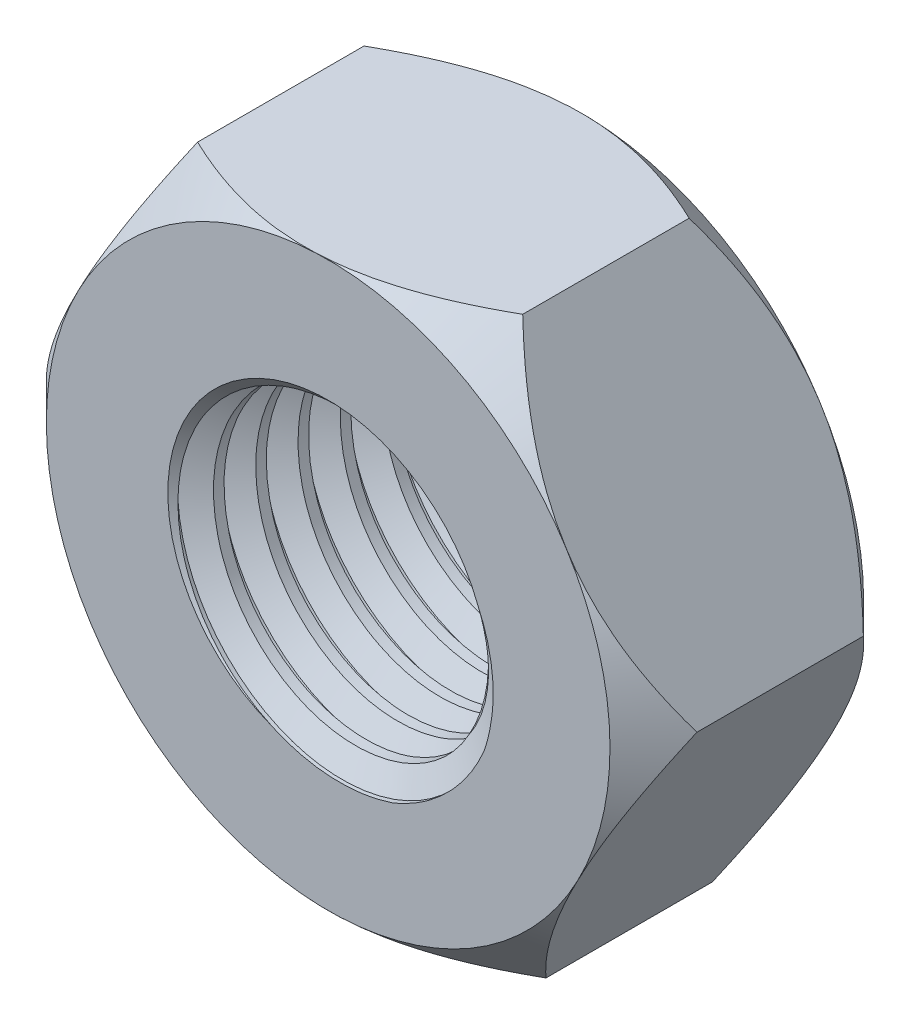
from build123d import *

# Parameters (mm, degrees)
BOSS_EXTRUDE1_DEPTH     = 4.5
SKETCH3_OUTSIDE_W       = 69.206
SKETCH3_OUTSIDE_H       = 66.592
SKETCH3_OUTSIDE_R       = 10
CUT_EXTRUDE1_DEPTH      = 18.853777356
CUT_EXTRUDE1_DRAFT      = -45
MIRROR1_COPY_1_SKETCH_W = 69.206
MIRROR1_COPY_1_SKETCH_H = 66.592
MIRROR1_COPY_1_SKETCH_R = 10
MIRROR1_COPY_1_DEPTH    = 18.853777356
MIRROR1_COPY_1_DRAFT    = -45
SKETCH4_R               = 5.19
CUT_EXTRUDE2_DEPTH      = 18.853777356
CHAMFER1_SIZE           = 0.5
THREAD1_PITCH           = 1.5


with BuildPart() as part:
    # Sketch2 → Boss-Extrude1 (new, symmetric)
    with BuildSketch(Plane.XY):
        Polygon((-11.537151797, -0.476929503), (-5.355542833, -10.229931295), (6.181608964, -9.753001792), (11.537151797, 0.476929503), (5.355542833, 10.229931295), (-6.181608964, 9.753001792), align=None)
    extrude(amount=BOSS_EXTRUDE1_DEPTH, both=True)


with BuildPart() as cut_extrude1_tool:
    # Sketch3 outside → Cut-Extrude1 (with draft: the straight prism first)
    with BuildSketch(Plane.XY.offset(4.5)):
        Rectangle(SKETCH3_OUTSIDE_W, SKETCH3_OUTSIDE_H)
        Circle(SKETCH3_OUTSIDE_R, mode=Mode.SUBTRACT)
    extrude(amount=-CUT_EXTRUDE1_DEPTH)
    # Cut-Extrude1: the draft: its side faces are tilted about the plane it starts from
    cut_extrude1_sides = [cut_extrude1_tool.faces().sort_by_distance(p)[0] for p in [
        (0, -33.296, -4.926888678),
        (34.603, 0, -4.926888678),
        (0, 33.296, -4.926888678),
        (-34.603, 0, -4.926888678),
        (-10, 0, -4.926888678),
    ]]
    draft(cut_extrude1_sides, Plane.XY.offset(4.5), CUT_EXTRUDE1_DRAFT)


with BuildPart() as part_1:
    add(part.part)

    # Cut-Extrude1: cut by cut_extrude1_tool
    add(cut_extrude1_tool.part, mode=Mode.SUBTRACT)


with BuildPart() as mirror1_copy_1_tool:
    # Mirror1 copy 1 sketch → Mirror1 copy 1 (with draft: the straight prism first)
    with BuildSketch(Plane(origin=(0, 0, -4.5), x_dir=(1, 0, 0), z_dir=(0, 0, -1))):
        Rectangle(MIRROR1_COPY_1_SKETCH_W, MIRROR1_COPY_1_SKETCH_H)
        Circle(MIRROR1_COPY_1_SKETCH_R, mode=Mode.SUBTRACT)
    extrude(amount=-MIRROR1_COPY_1_DEPTH)
    # Mirror1 copy 1: the draft: its side faces are tilted about the plane it starts from
    mirror1_copy_1_sides = [mirror1_copy_1_tool.faces().sort_by_distance(p)[0] for p in [
        (0, -33.296, 4.926888678),
        (34.603, 0, 4.926888678),
        (0, 33.296, 4.926888678),
        (-34.603, 0, 4.926888678),
        (-10, 0, 4.926888678),
    ]]
    draft(mirror1_copy_1_sides, Plane(origin=(0, 0, -4.5), x_dir=(1, 0, 0), z_dir=(0, 0, -1)), MIRROR1_COPY_1_DRAFT)


with BuildPart() as part_2:
    add(part_1.part)

    # Mirror1 copy 1: cut by mirror1_copy_1_tool
    add(mirror1_copy_1_tool.part, mode=Mode.SUBTRACT)

    # Sketch4 → Cut-Extrude2 (cut, through all)
    with BuildSketch(Plane.XY.offset(4.5)):
        Circle(SKETCH4_R)
    extrude(amount=-CUT_EXTRUDE2_DEPTH, mode=Mode.SUBTRACT)

    # Chamfer1
    chamfer1_edges = [part_2.edges().sort_by_distance(p)[0] for p in [
        (-5.19, 0, -4.5),
        (-5.19, 0, 4.5),
    ]]
    chamfer(chamfer1_edges, length=CHAMFER1_SIZE)

    # Thread1: the profile of Thread Profile1 profile screwed along a right-hand helix of 7 turns, 8 arcs to a turn; built about Z, then put on its axis
    thread1_z = Axis((0, 0, 0), (0, 0, 1))
    thread1_corners = [(5.1897, 0, -0.000173205), (6.001898813, 0, 0.468749998), (6.001898813, 0, 0.656249998), (5.1897, 0, 1.125173201)]
    with BuildLine(mode=Mode.PRIVATE) as thread1_profile:
        Line(thread1_corners[0], thread1_corners[1])
        Line(thread1_corners[1], thread1_corners[2])
        Line(thread1_corners[2], thread1_corners[3])
        Line(thread1_corners[3], thread1_corners[0])
    thread1_cap = Face(thread1_profile.wire())
    thread1_turn_angles = [0, 22.5, 45, 67.5, 90, 112.5, 135, 157.5, 180, 202.5, 225, 247.5, 270, 292.5, 315, 337.5, 360]
    thread1_turn_weights = [1, 0.9238795325112867, 1, 0.9238795325112867, 1, 0.9238795325112867, 1, 0.9238795325112867, 1, 0.9238795325112867, 1, 0.9238795325112867, 1, 0.9238795325112867, 1, 0.9238795325112867, 1]
    thread1_turn_rails = [Edge.make_bspline([Vector(p[0], p[1], 0).rotate(thread1_z, thread1_turn_angles[k]) / thread1_turn_weights[k] + Vector(0, 0, p[2] + THREAD1_PITCH * thread1_turn_angles[k] / 360) for k in range(17)], [0, 0, 0, 1, 1, 2, 2, 3, 3, 4, 4, 5, 5, 6, 6, 7, 7, 8, 8, 8], 2, thread1_turn_weights) for p in thread1_corners]
    thread1_turn_sides = [Face.make_surface_from_curves(thread1_turn_rails[p[0]], thread1_turn_rails[p[1]]) for p in [(0, 1), (1, 2), (2, 3), (3, 0)]]
    thread1 = Plane(origin=(0, 0, 6), x_dir=(-1, 0, 0), z_dir=(0, 0, -1)) * Solid(Shell([*[p.moved(Location((0, 0, THREAD1_PITCH * i))) for i in range(7) for p in thread1_turn_sides], thread1_cap, thread1_cap.rotate(thread1_z, 2520).moved(Location((0, 0, THREAD1_PITCH * 2520 / 360)))]))
    add(thread1, mode=Mode.SUBTRACT)


solid = part_2.part
